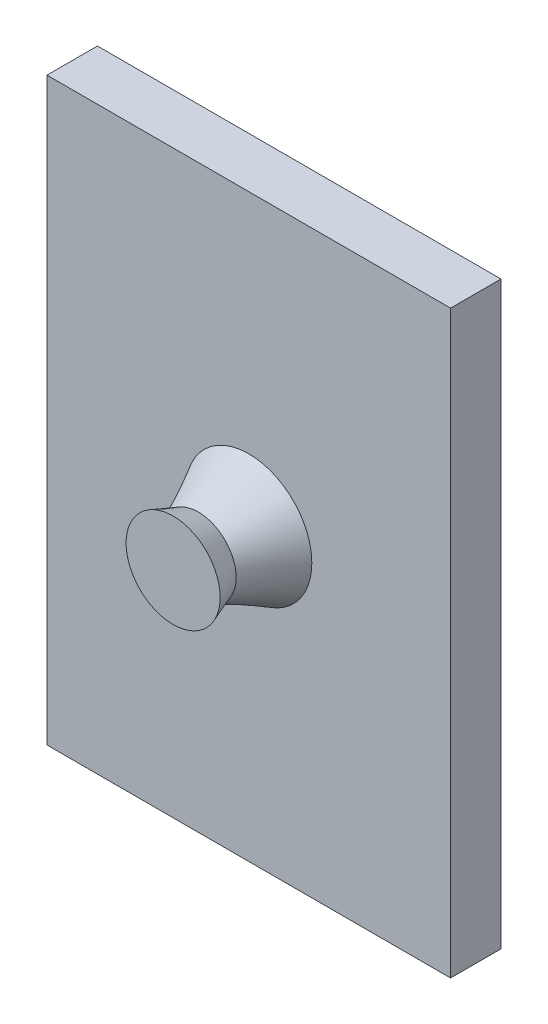
from build123d import *

# Parameters (mm, degrees)
SKETCH1_W           = 16
SKETCH1_H           = 23
BOSS_EXTRUDE1_DEPTH = 2
SKETCH6_R           = 1.5
BOSS_EXTRUDE3_DEPTH = 1
BOSS_EXTRUDE3_DRAFT = -20


with BuildPart() as part:
    # Sketch1 → Boss-Extrude1 (new body)
    with BuildSketch(Plane.XY):
        with Locations((8, 11.5)):
            Rectangle(SKETCH1_W, SKETCH1_H)
    extrude(amount=BOSS_EXTRUDE1_DEPTH)

    # Loft1: read off the stored shape, not the designer's step
    # Loft1: loft between two sections, ruled curve by curve
    loft1_from = [
        Edge.make_bspline([(10.5, 11.5, 2), (10.5, 16.5, 2), (5.5, 16.5, 2), (5.5, 11.5, 2), (5.5, 6.5, 2), (10.5, 6.5, 2), (10.5, 11.5, 2)], [0, 0, 0, 0, 0.5, 0.5, 0.5, 1, 1, 1, 1], 3, [1, 0.333333333, 0.333333333, 1, 0.333333333, 0.333333333, 1]),
    ]
    loft1_to = [
        Edge.make_bspline([(9.382185261, 10.91727888, 4), (10.547627501, 13.681649403, 4), (7.783256979, 14.847091642, 4), (6.617814739, 12.08272112, 4), (5.452372499, 9.318350597, 4), (8.216743021, 8.152908358, 4), (9.382185261, 10.91727888, 4)], [0, 0, 0, 0, 0.5, 0.5, 0.5, 1, 1, 1, 1], 3, [1, 0.333333333, 0.333333333, 1, 0.333333333, 0.333333333, 1]),
    ]
    loft1 = Solid(Shell([*[Face.make_surface_from_curves(loft1_from[k], loft1_to[k]) for k in range(1)], Face(Wire(loft1_from)), Face(Wire(loft1_to))]))
    add(loft1)


with BuildPart() as boss_extrude3_tool:
    # Sketch6 → Boss-Extrude3 (with draft: the straight prism first)
    with BuildSketch(Plane.XY.offset(4)):
        with Locations((8, 11.5)):
            Circle(SKETCH6_R)
    extrude(amount=BOSS_EXTRUDE3_DEPTH)
    # Boss-Extrude3: the draft: its side faces are tilted about the plane it starts from
    boss_extrude3_sides = [boss_extrude3_tool.faces().sort_by_distance(p)[0] for p in [
        (6.5, 11.5, 4.5),
    ]]
    draft(boss_extrude3_sides, Plane.XY.offset(4), BOSS_EXTRUDE3_DRAFT)


with BuildPart() as part_1:
    add(part.part)

    # Boss-Extrude3: add boss_extrude3_tool
    add(boss_extrude3_tool.part)


solid = part_1.part
